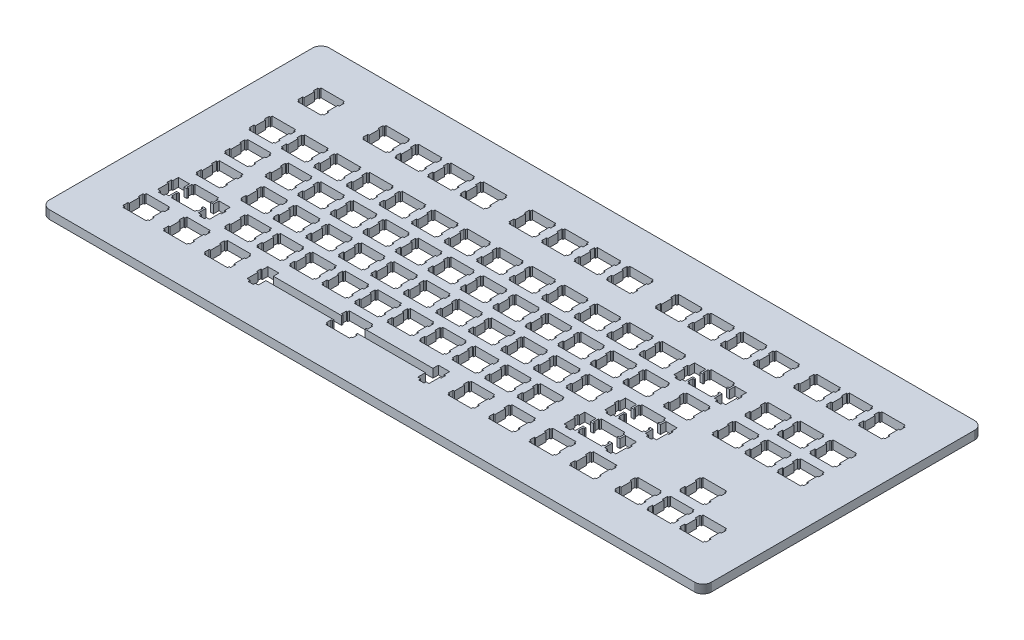
from build123d import *

# Parameters (mm, degrees)
BOSS_EXTRUDE1_DEPTH = 5


with BuildPart() as part:
    # Sketch1 → Boss-Extrude1 (new body)
    with BuildSketch(Plane(origin=(0, 0, 0), x_dir=(1, 0, 0), z_dir=(0, 1, 0))):
        Polygon((382.958, 164.299), (383.35, 164.284), (383.741, 164.237), (384.126, 164.162), (384.503, 164.055), (384.87, 163.919), (385.226, 163.755), (385.572, 163.564), (385.897, 163.344), (386.203, 163.102), (386.493, 162.834), (386.761, 162.547), (387.004, 162.238), (387.223, 161.913), (387.414, 161.569), (387.576, 161.212), (387.713, 160.845), (387.819, 160.467), (387.897, 160.082), (387.943, 159.693), (387.96, 159.299), (387.96, 5.27237), (387.943, 4.881), (387.897, 4.49104), (387.819, 4.10655), (387.713, 3.72759), (387.576, 3.35966), (387.414, 3.00412), (387.223, 2.66099), (387.004, 2.3344), (386.761, 2.02572), (386.493, 1.73771), (386.203, 1.47037), (385.897, 1.22783), (385.572, 1.0101), (385.226, 0.818554), (384.87, 0.654569), (384.503, 0.518142), (384.126, 0.412034), (383.741, 0.334863), (383.35, 0.289388), (382.958, 0.272852), (5.09598, 0.272852), (4.70186, 0.289388), (4.3119, 0.334863), (3.9274, 0.412034), (3.54983, 0.518142), (3.18189, 0.654569), (2.82498, 0.818554), (2.48185, 1.0101), (2.15663, 1.22783), (1.84795, 1.47037), (1.55994, 1.73771), (1.2926, 2.02572), (1.05006, 2.3344), (0.830957, 2.66099), (0.63941, 3.00412), (0.475424, 3.35966), (0.338998, 3.72759), (0.232888, 4.10655), (0.157097, 4.49104), (0.110243, 4.881), (0.0950846, 5.27375), (0.0950846, 159.299), (0.110243, 159.693), (0.157097, 160.082), (0.232888, 160.467), (0.338998, 160.845), (0.475424, 161.212), (0.63941, 161.569), (0.830957, 161.913), (1.05006, 162.238), (1.2926, 162.547), (1.55994, 162.834), (1.84795, 163.102), (2.15663, 163.344), (2.48185, 163.564), (2.82498, 163.755), (3.18189, 163.919), (3.54983, 164.055), (3.9274, 164.162), (4.3119, 164.237), (4.70186, 164.284), (5.09598, 164.299), align=None)
        Polygon((144.264, 36.7993), (144.264, 35.7988), (143.463, 35.7988), (143.463, 32.8993), (144.264, 32.8993), (144.264, 32.0986), (104.439, 32.0986), (104.439, 35.3289), (97.8888, 35.3289), (97.8888, 32.0986), (97.0636, 32.0986), (97.0636, 29.4983), (97.8888, 29.4983), (97.8888, 23.2296), (99.6128, 23.2296), (99.6128, 22.0293), (102.713, 22.0293), (102.713, 23.2296), (104.439, 23.2296), (104.439, 27.6986), (144.264, 27.6986), (144.264, 26.8993), (143.463, 26.8993), (143.463, 23.9985), (144.264, 23.9985), (144.264, 22.9995), (158.064, 22.9995), (158.064, 23.9985), (158.863, 23.9985), (158.863, 26.8993), (158.064, 26.8993), (158.064, 27.6986), (197.889, 27.6986), (197.889, 23.2296), (199.613, 23.2296), (199.613, 22.0293), (202.714, 22.0293), (202.714, 23.2296), (204.439, 23.2296), (204.439, 29.4983), (205.263, 29.4983), (205.263, 32.0986), (204.439, 32.0986), (204.439, 35.3289), (197.889, 35.3289), (197.889, 32.0986), (158.064, 32.0986), (158.064, 32.8993), (158.863, 32.8993), (158.863, 35.7988), (158.064, 35.7988), (158.064, 36.7993), align=None, mode=Mode.SUBTRACT)
        Polygon((351.433, 36.7993), (351.433, 35.7988), (350.632, 35.7988), (350.632, 32.8993), (351.433, 32.8993), (351.433, 26.8993), (350.632, 26.8993), (350.632, 23.9985), (351.433, 23.9985), (351.433, 22.9995), (365.231, 22.9995), (365.231, 23.9985), (366.032, 23.9985), (366.032, 26.8993), (365.231, 26.8993), (365.231, 32.8993), (366.032, 32.8993), (366.032, 35.7988), (365.231, 35.7988), (365.231, 36.7993), align=None, mode=Mode.SUBTRACT)
        Polygon((332.383, 36.7993), (332.383, 35.7988), (331.582, 35.7988), (331.582, 32.8993), (332.383, 32.8993), (332.383, 26.8993), (331.582, 26.8993), (331.582, 23.9985), (332.383, 23.9985), (332.383, 22.9995), (346.183, 22.9995), (346.183, 23.9985), (346.983, 23.9985), (346.983, 26.8993), (346.183, 26.8993), (346.183, 32.8993), (346.983, 32.8993), (346.983, 35.7988), (346.183, 35.7988), (346.183, 36.7993), align=None, mode=Mode.SUBTRACT)
        Polygon((313.333, 36.7993), (313.333, 35.7988), (312.532, 35.7988), (312.532, 32.8993), (313.333, 32.8993), (313.333, 26.8993), (312.532, 26.8993), (312.532, 23.9985), (313.333, 23.9985), (313.333, 22.9995), (327.133, 22.9995), (327.133, 23.9985), (327.933, 23.9985), (327.933, 26.8993), (327.133, 26.8993), (327.133, 32.8993), (327.933, 32.8993), (327.933, 35.7988), (327.133, 35.7988), (327.133, 36.7993), align=None, mode=Mode.SUBTRACT)
        Polygon((287.139, 36.7993), (287.139, 35.7988), (286.338, 35.7988), (286.338, 32.8993), (287.139, 32.8993), (287.139, 26.8993), (286.338, 26.8993), (286.338, 23.9985), (287.139, 23.9985), (287.139, 22.9995), (300.939, 22.9995), (300.939, 23.9985), (301.738, 23.9985), (301.738, 26.8993), (300.939, 26.8993), (300.939, 32.8993), (301.738, 32.8993), (301.738, 35.7988), (300.939, 35.7988), (300.939, 36.7993), align=None, mode=Mode.SUBTRACT)
        Polygon((263.327, 36.7993), (263.327, 35.7988), (262.526, 35.7988), (262.526, 32.8993), (263.327, 32.8993), (263.327, 26.8993), (262.526, 26.8993), (262.526, 23.9985), (263.327, 23.9985), (263.327, 22.9995), (277.126, 22.9995), (277.126, 23.9985), (277.927, 23.9985), (277.927, 26.8993), (277.126, 26.8993), (277.126, 32.8993), (277.927, 32.8993), (277.927, 35.7988), (277.126, 35.7988), (277.126, 36.7993), align=None, mode=Mode.SUBTRACT)
        Polygon((239.514, 36.7993), (239.514, 35.7988), (238.713, 35.7988), (238.713, 32.8993), (239.514, 32.8993), (239.514, 26.8993), (238.713, 26.8993), (238.713, 23.9985), (239.514, 23.9985), (239.514, 22.9995), (253.314, 22.9995), (253.314, 23.9985), (254.113, 23.9985), (254.113, 26.8993), (253.314, 26.8993), (253.314, 32.8993), (254.113, 32.8993), (254.113, 35.7988), (253.314, 35.7988), (253.314, 36.7993), align=None, mode=Mode.SUBTRACT)
        Polygon((215.702, 36.7993), (215.702, 35.7988), (214.901, 35.7988), (214.901, 32.8993), (215.702, 32.8993), (215.702, 26.8993), (214.901, 26.8993), (214.901, 23.9985), (215.702, 23.9985), (215.702, 22.9995), (229.501, 22.9995), (229.501, 23.9985), (230.302, 23.9985), (230.302, 26.8993), (229.501, 26.8993), (229.501, 32.8993), (230.302, 32.8993), (230.302, 35.7988), (229.501, 35.7988), (229.501, 36.7993), align=None, mode=Mode.SUBTRACT)
        Polygon((72.8267, 36.7993), (72.8267, 35.7988), (72.0259, 35.7988), (72.0259, 32.8993), (72.8267, 32.8993), (72.8267, 26.8993), (72.0259, 26.8993), (72.0259, 23.9985), (72.8267, 23.9985), (72.8267, 22.9995), (86.6263, 22.9995), (86.6263, 23.9985), (87.4268, 23.9985), (87.4268, 26.8993), (86.6263, 26.8993), (86.6263, 32.8993), (87.4268, 32.8993), (87.4268, 35.7988), (86.6263, 35.7988), (86.6263, 36.7993), align=None, mode=Mode.SUBTRACT)
        Polygon((49.0142, 36.7993), (49.0142, 35.7988), (48.2134, 35.7988), (48.2134, 32.8993), (49.0142, 32.8993), (49.0142, 26.8993), (48.2134, 26.8993), (48.2134, 23.9985), (49.0142, 23.9985), (49.0142, 22.9995), (62.8138, 22.9995), (62.8138, 23.9985), (63.6129, 23.9985), (63.6129, 26.8993), (62.8138, 26.8993), (62.8138, 32.8993), (63.6129, 32.8993), (63.6129, 35.7988), (62.8138, 35.7988), (62.8138, 36.7993), align=None, mode=Mode.SUBTRACT)
        Polygon((25.2016, 36.7993), (25.2016, 35.7988), (24.4009, 35.7988), (24.4009, 32.8993), (25.2016, 32.8993), (25.2016, 26.8993), (24.4009, 26.8993), (24.4009, 23.9985), (25.2016, 23.9985), (25.2016, 22.9995), (39.0013, 22.9995), (39.0013, 23.9985), (39.8018, 23.9985), (39.8018, 26.8993), (39.0013, 26.8993), (39.0013, 32.8993), (39.8018, 32.8993), (39.8018, 35.7988), (39.0013, 35.7988), (39.0013, 36.7993), align=None, mode=Mode.SUBTRACT)
        Polygon((272.852, 55.8504), (272.852, 54.8499), (272.051, 54.8499), (272.051, 51.9493), (272.852, 51.9493), (272.852, 51.15), (271.126, 51.15), (271.126, 54.38), (264.576, 54.38), (264.576, 51.15), (263.751, 51.15), (263.751, 48.5482), (264.576, 48.5482), (264.576, 42.2797), (266.302, 42.2797), (266.302, 41.0792), (269.401, 41.0792), (269.401, 42.2797), (271.126, 42.2797), (271.126, 46.7487), (272.852, 46.7487), (272.852, 45.9493), (272.051, 45.9493), (272.051, 43.0484), (272.852, 43.0484), (272.852, 42.0493), (286.651, 42.0493), (286.651, 43.0484), (287.452, 43.0484), (287.452, 45.9493), (286.651, 45.9493), (286.651, 46.7487), (288.376, 46.7487), (288.376, 42.2797), (290.102, 42.2797), (290.102, 41.0792), (293.201, 41.0792), (293.201, 42.2797), (294.926, 42.2797), (294.926, 48.5482), (295.752, 48.5482), (295.752, 51.15), (294.926, 51.15), (294.926, 54.38), (288.376, 54.38), (288.376, 51.15), (286.651, 51.15), (286.651, 51.9493), (287.452, 51.9493), (287.452, 54.8499), (286.651, 54.8499), (286.651, 55.8504), align=None, mode=Mode.SUBTRACT)
        Polygon((34.7266, 55.8504), (34.7266, 54.8499), (33.9259, 54.8499), (33.9259, 51.9493), (34.7266, 51.9493), (34.7266, 51.15), (33.0013, 51.15), (33.0013, 54.38), (26.4515, 54.38), (26.4515, 51.15), (25.626, 51.15), (25.626, 48.5482), (26.4515, 48.5482), (26.4515, 42.2797), (28.1767, 42.2797), (28.1767, 41.0792), (31.276, 41.0792), (31.276, 42.2797), (33.0013, 42.2797), (33.0013, 46.7487), (34.7266, 46.7487), (34.7266, 45.9493), (33.9259, 45.9493), (33.9259, 43.0484), (34.7266, 43.0484), (34.7266, 42.0493), (48.5263, 42.0493), (48.5263, 43.0484), (49.3268, 43.0484), (49.3268, 45.9493), (48.5263, 45.9493), (48.5263, 46.7487), (50.2514, 46.7487), (50.2514, 42.2797), (51.9769, 42.2797), (51.9769, 41.0792), (55.076, 41.0792), (55.076, 42.2797), (56.8015, 42.2797), (56.8015, 48.5482), (57.627, 48.5482), (57.627, 51.15), (56.8015, 51.15), (56.8015, 54.38), (50.2514, 54.38), (50.2514, 51.15), (48.5263, 51.15), (48.5263, 51.9493), (49.3268, 51.9493), (49.3268, 54.8499), (48.5263, 54.8499), (48.5263, 55.8504), align=None, mode=Mode.SUBTRACT)
        Polygon((332.383, 55.8504), (332.383, 54.8499), (331.582, 54.8499), (331.582, 51.9493), (332.383, 51.9493), (332.383, 45.9493), (331.582, 45.9493), (331.582, 43.0484), (332.383, 43.0484), (332.383, 42.0493), (346.183, 42.0493), (346.183, 43.0484), (346.983, 43.0484), (346.983, 45.9493), (346.183, 45.9493), (346.183, 51.9493), (346.983, 51.9493), (346.983, 54.8499), (346.183, 54.8499), (346.183, 55.8504), align=None, mode=Mode.SUBTRACT)
        Polygon((237.133, 55.8504), (237.133, 54.8499), (236.332, 54.8499), (236.332, 51.9493), (237.133, 51.9493), (237.133, 45.9493), (236.332, 45.9493), (236.332, 43.0484), (237.133, 43.0484), (237.133, 42.0493), (250.933, 42.0493), (250.933, 43.0484), (251.733, 43.0484), (251.733, 45.9493), (250.933, 45.9493), (250.933, 51.9493), (251.733, 51.9493), (251.733, 54.8499), (250.933, 54.8499), (250.933, 55.8504), align=None, mode=Mode.SUBTRACT)
        Polygon((218.083, 55.8504), (218.083, 54.8499), (217.282, 54.8499), (217.282, 51.9493), (218.083, 51.9493), (218.083, 45.9493), (217.282, 45.9493), (217.282, 43.0484), (218.083, 43.0484), (218.083, 42.0493), (231.883, 42.0493), (231.883, 43.0484), (232.683, 43.0484), (232.683, 45.9493), (231.883, 45.9493), (231.883, 51.9493), (232.683, 51.9493), (232.683, 54.8499), (231.883, 54.8499), (231.883, 55.8504), align=None, mode=Mode.SUBTRACT)
        Polygon((199.033, 55.8504), (199.033, 54.8499), (198.232, 54.8499), (198.232, 51.9493), (199.033, 51.9493), (199.033, 45.9493), (198.232, 45.9493), (198.232, 43.0484), (199.033, 43.0484), (199.033, 42.0493), (212.833, 42.0493), (212.833, 43.0484), (213.633, 43.0484), (213.633, 45.9493), (212.833, 45.9493), (212.833, 51.9493), (213.633, 51.9493), (213.633, 54.8499), (212.833, 54.8499), (212.833, 55.8504), align=None, mode=Mode.SUBTRACT)
        Polygon((179.983, 55.8504), (179.983, 54.8499), (179.182, 54.8499), (179.182, 51.9493), (179.983, 51.9493), (179.983, 45.9493), (179.182, 45.9493), (179.182, 43.0484), (179.983, 43.0484), (179.983, 42.0493), (193.783, 42.0493), (193.783, 43.0484), (194.583, 43.0484), (194.583, 45.9493), (193.783, 45.9493), (193.783, 51.9493), (194.583, 51.9493), (194.583, 54.8499), (193.783, 54.8499), (193.783, 55.8504), align=None, mode=Mode.SUBTRACT)
        Polygon((160.933, 55.8504), (160.933, 54.8499), (160.132, 54.8499), (160.132, 51.9493), (160.933, 51.9493), (160.933, 45.9493), (160.132, 45.9493), (160.132, 43.0484), (160.933, 43.0484), (160.933, 42.0493), (174.733, 42.0493), (174.733, 43.0484), (175.533, 43.0484), (175.533, 45.9493), (174.733, 45.9493), (174.733, 51.9493), (175.533, 51.9493), (175.533, 54.8499), (174.733, 54.8499), (174.733, 55.8504), align=None, mode=Mode.SUBTRACT)
        Polygon((141.883, 55.8504), (141.883, 54.8499), (141.082, 54.8499), (141.082, 51.9493), (141.883, 51.9493), (141.883, 45.9493), (141.082, 45.9493), (141.082, 43.0484), (141.883, 43.0484), (141.883, 42.0493), (155.683, 42.0493), (155.683, 43.0484), (156.483, 43.0484), (156.483, 45.9493), (155.683, 45.9493), (155.683, 51.9493), (156.483, 51.9493), (156.483, 54.8499), (155.683, 54.8499), (155.683, 55.8504), align=None, mode=Mode.SUBTRACT)
        Polygon((122.833, 55.8504), (122.833, 54.8499), (122.032, 54.8499), (122.032, 51.9493), (122.833, 51.9493), (122.833, 45.9493), (122.032, 45.9493), (122.032, 43.0484), (122.833, 43.0484), (122.833, 42.0493), (136.633, 42.0493), (136.633, 43.0484), (137.433, 43.0484), (137.433, 45.9493), (136.633, 45.9493), (136.633, 51.9493), (137.433, 51.9493), (137.433, 54.8499), (136.633, 54.8499), (136.633, 55.8504), align=None, mode=Mode.SUBTRACT)
        Polygon((103.783, 55.8504), (103.783, 54.8499), (102.982, 54.8499), (102.982, 51.9493), (103.783, 51.9493), (103.783, 45.9493), (102.982, 45.9493), (102.982, 43.0484), (103.783, 43.0484), (103.783, 42.0493), (117.583, 42.0493), (117.583, 43.0484), (118.383, 43.0484), (118.383, 45.9493), (117.583, 45.9493), (117.583, 51.9493), (118.383, 51.9493), (118.383, 54.8499), (117.583, 54.8499), (117.583, 55.8504), align=None, mode=Mode.SUBTRACT)
        Polygon((84.733, 55.8504), (84.733, 54.8499), (83.9322, 54.8499), (83.9322, 51.9493), (84.733, 51.9493), (84.733, 45.9493), (83.9322, 45.9493), (83.9322, 43.0484), (84.733, 43.0484), (84.733, 42.0493), (98.5326, 42.0493), (98.5326, 43.0484), (99.3331, 43.0484), (99.3331, 45.9493), (98.5326, 45.9493), (98.5326, 51.9493), (99.3331, 51.9493), (99.3331, 54.8499), (98.5326, 54.8499), (98.5326, 55.8504), align=None, mode=Mode.SUBTRACT)
        Polygon((65.683, 55.8504), (65.683, 54.8499), (64.8822, 54.8499), (64.8822, 51.9493), (65.683, 51.9493), (65.683, 45.9493), (64.8822, 45.9493), (64.8822, 43.0484), (65.683, 43.0484), (65.683, 42.0493), (79.4826, 42.0493), (79.4826, 43.0484), (80.2831, 43.0484), (80.2831, 45.9493), (79.4826, 45.9493), (79.4826, 51.9493), (80.2831, 51.9493), (80.2831, 54.8499), (79.4826, 54.8499), (79.4826, 55.8504), align=None, mode=Mode.SUBTRACT)
        Polygon((277.614, 74.9004), (277.614, 73.8999), (276.813, 73.8999), (276.813, 70.9993), (277.614, 70.9993), (277.614, 70.1985), (275.889, 70.1985), (275.889, 73.43), (269.339, 73.43), (269.339, 70.1985), (268.514, 70.1985), (268.514, 67.5982), (269.339, 67.5982), (269.339, 61.3297), (271.063, 61.3297), (271.063, 60.1292), (274.163, 60.1292), (274.163, 61.3297), (275.889, 61.3297), (275.889, 65.7987), (277.614, 65.7987), (277.614, 64.9993), (276.813, 64.9993), (276.813, 62.0984), (277.614, 62.0984), (277.614, 61.0994), (291.414, 61.0994), (291.414, 62.0984), (292.213, 62.0984), (292.213, 64.9993), (291.414, 64.9993), (291.414, 65.7987), (293.139, 65.7987), (293.139, 61.3297), (294.863, 61.3297), (294.863, 60.1292), (297.964, 60.1292), (297.964, 61.3297), (299.689, 61.3297), (299.689, 67.5982), (300.513, 67.5982), (300.513, 70.1985), (299.689, 70.1985), (299.689, 73.43), (293.139, 73.43), (293.139, 70.1985), (291.414, 70.1985), (291.414, 70.9993), (292.213, 70.9993), (292.213, 73.8999), (291.414, 73.8999), (291.414, 74.9004), align=None, mode=Mode.SUBTRACT)
        Polygon((246.658, 74.9004), (246.658, 73.8999), (245.857, 73.8999), (245.857, 70.9993), (246.658, 70.9993), (246.658, 64.9993), (245.857, 64.9993), (245.857, 62.0984), (246.658, 62.0984), (246.658, 61.0994), (260.458, 61.0994), (260.458, 62.0984), (261.258, 62.0984), (261.258, 64.9993), (260.458, 64.9993), (260.458, 70.9993), (261.258, 70.9993), (261.258, 73.8999), (260.458, 73.8999), (260.458, 74.9004), align=None, mode=Mode.SUBTRACT)
        Polygon((227.608, 74.9004), (227.608, 73.8999), (226.807, 73.8999), (226.807, 70.9993), (227.608, 70.9993), (227.608, 64.9993), (226.807, 64.9993), (226.807, 62.0984), (227.608, 62.0984), (227.608, 61.0994), (241.408, 61.0994), (241.408, 62.0984), (242.208, 62.0984), (242.208, 64.9993), (241.408, 64.9993), (241.408, 70.9993), (242.208, 70.9993), (242.208, 73.8999), (241.408, 73.8999), (241.408, 74.9004), align=None, mode=Mode.SUBTRACT)
        Polygon((208.558, 74.9004), (208.558, 73.8999), (207.757, 73.8999), (207.757, 70.9993), (208.558, 70.9993), (208.558, 64.9993), (207.757, 64.9993), (207.757, 62.0984), (208.558, 62.0984), (208.558, 61.0994), (222.358, 61.0994), (222.358, 62.0984), (223.158, 62.0984), (223.158, 64.9993), (222.358, 64.9993), (222.358, 70.9993), (223.158, 70.9993), (223.158, 73.8999), (222.358, 73.8999), (222.358, 74.9004), align=None, mode=Mode.SUBTRACT)
        Polygon((189.508, 74.9004), (189.508, 73.8999), (188.707, 73.8999), (188.707, 70.9993), (189.508, 70.9993), (189.508, 64.9993), (188.707, 64.9993), (188.707, 62.0984), (189.508, 62.0984), (189.508, 61.0994), (203.308, 61.0994), (203.308, 62.0984), (204.108, 62.0984), (204.108, 64.9993), (203.308, 64.9993), (203.308, 70.9993), (204.108, 70.9993), (204.108, 73.8999), (203.308, 73.8999), (203.308, 74.9004), align=None, mode=Mode.SUBTRACT)
        Polygon((170.458, 74.9004), (170.458, 73.8999), (169.657, 73.8999), (169.657, 70.9993), (170.458, 70.9993), (170.458, 64.9993), (169.657, 64.9993), (169.657, 62.0984), (170.458, 62.0984), (170.458, 61.0994), (184.258, 61.0994), (184.258, 62.0984), (185.058, 62.0984), (185.058, 64.9993), (184.258, 64.9993), (184.258, 70.9993), (185.058, 70.9993), (185.058, 73.8999), (184.258, 73.8999), (184.258, 74.9004), align=None, mode=Mode.SUBTRACT)
        Polygon((151.408, 74.9004), (151.408, 73.8999), (150.607, 73.8999), (150.607, 70.9993), (151.408, 70.9993), (151.408, 64.9993), (150.607, 64.9993), (150.607, 62.0984), (151.408, 62.0984), (151.408, 61.0994), (165.208, 61.0994), (165.208, 62.0984), (166.008, 62.0984), (166.008, 64.9993), (165.208, 64.9993), (165.208, 70.9993), (166.008, 70.9993), (166.008, 73.8999), (165.208, 73.8999), (165.208, 74.9004), align=None, mode=Mode.SUBTRACT)
        Polygon((132.358, 74.9004), (132.358, 73.8999), (131.557, 73.8999), (131.557, 70.9993), (132.358, 70.9993), (132.358, 64.9993), (131.557, 64.9993), (131.557, 62.0984), (132.358, 62.0984), (132.358, 61.0994), (146.158, 61.0994), (146.158, 62.0984), (146.958, 62.0984), (146.958, 64.9993), (146.158, 64.9993), (146.158, 70.9993), (146.958, 70.9993), (146.958, 73.8999), (146.158, 73.8999), (146.158, 74.9004), align=None, mode=Mode.SUBTRACT)
        Polygon((113.308, 74.9004), (113.308, 73.8999), (112.507, 73.8999), (112.507, 70.9993), (113.308, 70.9993), (113.308, 64.9993), (112.507, 64.9993), (112.507, 62.0984), (113.308, 62.0984), (113.308, 61.0994), (127.108, 61.0994), (127.108, 62.0984), (127.908, 62.0984), (127.908, 64.9993), (127.108, 64.9993), (127.108, 70.9993), (127.908, 70.9993), (127.908, 73.8999), (127.108, 73.8999), (127.108, 74.9004), align=None, mode=Mode.SUBTRACT)
        Polygon((94.258, 74.9004), (94.258, 73.8999), (93.4572, 73.8999), (93.4572, 70.9993), (94.258, 70.9993), (94.258, 64.9993), (93.4572, 64.9993), (93.4572, 62.0984), (94.258, 62.0984), (94.258, 61.0994), (108.058, 61.0994), (108.058, 62.0984), (108.858, 62.0984), (108.858, 64.9993), (108.058, 64.9993), (108.058, 70.9993), (108.858, 70.9993), (108.858, 73.8999), (108.058, 73.8999), (108.058, 74.9004), align=None, mode=Mode.SUBTRACT)
        Polygon((75.208, 74.9004), (75.208, 73.8999), (74.4072, 73.8999), (74.4072, 70.9993), (75.208, 70.9993), (75.208, 64.9993), (74.4072, 64.9993), (74.4072, 62.0984), (75.208, 62.0984), (75.208, 61.0994), (89.0076, 61.0994), (89.0076, 62.0984), (89.8081, 62.0984), (89.8081, 64.9993), (89.0076, 64.9993), (89.0076, 70.9993), (89.8081, 70.9993), (89.8081, 73.8999), (89.0076, 73.8999), (89.0076, 74.9004), align=None, mode=Mode.SUBTRACT)
        Polygon((56.158, 74.9004), (56.158, 73.8999), (55.3572, 73.8999), (55.3572, 70.9993), (56.158, 70.9993), (56.158, 64.9993), (55.3572, 64.9993), (55.3572, 62.0984), (56.158, 62.0984), (56.158, 61.0994), (69.9576, 61.0994), (69.9576, 62.0984), (70.7581, 62.0984), (70.7581, 64.9993), (69.9576, 64.9993), (69.9576, 70.9993), (70.7581, 70.9993), (70.7581, 73.8999), (69.9576, 73.8999), (69.9576, 74.9004), align=None, mode=Mode.SUBTRACT)
        Polygon((29.9641, 74.9004), (29.9641, 73.8999), (29.1634, 73.8999), (29.1634, 70.9993), (29.9641, 70.9993), (29.9641, 64.9993), (29.1634, 64.9993), (29.1634, 62.0984), (29.9641, 62.0984), (29.9641, 61.0994), (43.7638, 61.0994), (43.7638, 62.0984), (44.5629, 62.0984), (44.5629, 64.9993), (43.7638, 64.9993), (43.7638, 70.9993), (44.5629, 70.9993), (44.5629, 73.8999), (43.7638, 73.8999), (43.7638, 74.9004), align=None, mode=Mode.SUBTRACT)
        Polygon((351.433, 93.9493), (351.433, 92.9488), (350.632, 92.9488), (350.632, 90.0493), (351.433, 90.0493), (351.433, 84.0493), (350.632, 84.0493), (350.632, 81.1484), (351.433, 81.1484), (351.433, 80.1494), (365.231, 80.1494), (365.231, 81.1484), (366.032, 81.1484), (366.032, 84.0493), (365.231, 84.0493), (365.231, 90.0493), (366.032, 90.0493), (366.032, 92.9488), (365.231, 92.9488), (365.231, 93.9493), align=None, mode=Mode.SUBTRACT)
        Polygon((332.383, 93.9493), (332.383, 92.9488), (331.582, 92.9488), (331.582, 90.0493), (332.383, 90.0493), (332.383, 84.0493), (331.582, 84.0493), (331.582, 81.1484), (332.383, 81.1484), (332.383, 80.1494), (346.183, 80.1494), (346.183, 81.1484), (346.983, 81.1484), (346.983, 84.0493), (346.183, 84.0493), (346.183, 90.0493), (346.983, 90.0493), (346.983, 92.9488), (346.183, 92.9488), (346.183, 93.9493), align=None, mode=Mode.SUBTRACT)
        Polygon((313.333, 93.9493), (313.333, 92.9488), (312.532, 92.9488), (312.532, 90.0493), (313.333, 90.0493), (313.333, 84.0493), (312.532, 84.0493), (312.532, 81.1484), (313.333, 81.1484), (313.333, 80.1494), (327.133, 80.1494), (327.133, 81.1484), (327.933, 81.1484), (327.933, 84.0493), (327.133, 84.0493), (327.133, 90.0493), (327.933, 90.0493), (327.933, 92.9488), (327.133, 92.9488), (327.133, 93.9493), align=None, mode=Mode.SUBTRACT)
        Polygon((284.758, 93.9493), (284.758, 92.9488), (283.957, 92.9488), (283.957, 90.0493), (284.758, 90.0493), (284.758, 84.0493), (283.957, 84.0493), (283.957, 81.1484), (284.758, 81.1484), (284.758, 80.1494), (298.558, 80.1494), (298.558, 81.1484), (299.358, 81.1484), (299.358, 84.0493), (298.558, 84.0493), (298.558, 90.0493), (299.358, 90.0493), (299.358, 92.9488), (298.558, 92.9488), (298.558, 93.9493), align=None, mode=Mode.SUBTRACT)
        Polygon((260.945, 93.9493), (260.945, 92.9488), (260.146, 92.9488), (260.146, 90.0493), (260.945, 90.0493), (260.945, 84.0493), (260.146, 84.0493), (260.146, 81.1484), (260.945, 81.1484), (260.945, 80.1494), (274.745, 80.1494), (274.745, 81.1484), (275.546, 81.1484), (275.546, 84.0493), (274.745, 84.0493), (274.745, 90.0493), (275.546, 90.0493), (275.546, 92.9488), (274.745, 92.9488), (274.745, 93.9493), align=None, mode=Mode.SUBTRACT)
        Polygon((241.895, 93.9493), (241.895, 92.9488), (241.096, 92.9488), (241.096, 90.0493), (241.895, 90.0493), (241.895, 84.0493), (241.096, 84.0493), (241.096, 81.1484), (241.895, 81.1484), (241.895, 80.1494), (255.695, 80.1494), (255.695, 81.1484), (256.494, 81.1484), (256.494, 84.0493), (255.695, 84.0493), (255.695, 90.0493), (256.494, 90.0493), (256.494, 92.9488), (255.695, 92.9488), (255.695, 93.9493), align=None, mode=Mode.SUBTRACT)
        Polygon((222.845, 93.9493), (222.845, 92.9488), (222.046, 92.9488), (222.046, 90.0493), (222.845, 90.0493), (222.845, 84.0493), (222.046, 84.0493), (222.046, 81.1484), (222.845, 81.1484), (222.845, 80.1494), (236.645, 80.1494), (236.645, 81.1484), (237.446, 81.1484), (237.446, 84.0493), (236.645, 84.0493), (236.645, 90.0493), (237.446, 90.0493), (237.446, 92.9488), (236.645, 92.9488), (236.645, 93.9493), align=None, mode=Mode.SUBTRACT)
        Polygon((203.795, 93.9493), (203.795, 92.9488), (202.996, 92.9488), (202.996, 90.0493), (203.795, 90.0493), (203.795, 84.0493), (202.996, 84.0493), (202.996, 81.1484), (203.795, 81.1484), (203.795, 80.1494), (217.595, 80.1494), (217.595, 81.1484), (218.396, 81.1484), (218.396, 84.0493), (217.595, 84.0493), (217.595, 90.0493), (218.396, 90.0493), (218.396, 92.9488), (217.595, 92.9488), (217.595, 93.9493), align=None, mode=Mode.SUBTRACT)
        Polygon((184.745, 93.9493), (184.745, 92.9488), (183.946, 92.9488), (183.946, 90.0493), (184.745, 90.0493), (184.745, 84.0493), (183.946, 84.0493), (183.946, 81.1484), (184.745, 81.1484), (184.745, 80.1494), (198.545, 80.1494), (198.545, 81.1484), (199.346, 81.1484), (199.346, 84.0493), (198.545, 84.0493), (198.545, 90.0493), (199.346, 90.0493), (199.346, 92.9488), (198.545, 92.9488), (198.545, 93.9493), align=None, mode=Mode.SUBTRACT)
        Polygon((165.695, 93.9493), (165.695, 92.9488), (164.896, 92.9488), (164.896, 90.0493), (165.695, 90.0493), (165.695, 84.0493), (164.896, 84.0493), (164.896, 81.1484), (165.695, 81.1484), (165.695, 80.1494), (179.495, 80.1494), (179.495, 81.1484), (180.296, 81.1484), (180.296, 84.0493), (179.495, 84.0493), (179.495, 90.0493), (180.296, 90.0493), (180.296, 92.9488), (179.495, 92.9488), (179.495, 93.9493), align=None, mode=Mode.SUBTRACT)
        Polygon((146.645, 93.9493), (146.645, 92.9488), (145.846, 92.9488), (145.846, 90.0493), (146.645, 90.0493), (146.645, 84.0493), (145.846, 84.0493), (145.846, 81.1484), (146.645, 81.1484), (146.645, 80.1494), (160.445, 80.1494), (160.445, 81.1484), (161.246, 81.1484), (161.246, 84.0493), (160.445, 84.0493), (160.445, 90.0493), (161.246, 90.0493), (161.246, 92.9488), (160.445, 92.9488), (160.445, 93.9493), align=None, mode=Mode.SUBTRACT)
        Polygon((127.595, 93.9493), (127.595, 92.9488), (126.796, 92.9488), (126.796, 90.0493), (127.595, 90.0493), (127.595, 84.0493), (126.796, 84.0493), (126.796, 81.1484), (127.595, 81.1484), (127.595, 80.1494), (141.395, 80.1494), (141.395, 81.1484), (142.196, 81.1484), (142.196, 84.0493), (141.395, 84.0493), (141.395, 90.0493), (142.196, 90.0493), (142.196, 92.9488), (141.395, 92.9488), (141.395, 93.9493), align=None, mode=Mode.SUBTRACT)
        Polygon((108.544, 93.9493), (108.544, 92.9488), (107.745, 92.9488), (107.745, 90.0493), (108.544, 90.0493), (108.544, 84.0493), (107.745, 84.0493), (107.745, 81.1484), (108.544, 81.1484), (108.544, 80.1494), (122.345, 80.1494), (122.345, 81.1484), (123.144, 81.1484), (123.144, 84.0493), (122.345, 84.0493), (122.345, 90.0493), (123.144, 90.0493), (123.144, 92.9488), (122.345, 92.9488), (122.345, 93.9493), align=None, mode=Mode.SUBTRACT)
        Polygon((89.4941, 93.9493), (89.4941, 92.9488), (88.6961, 92.9488), (88.6961, 90.0493), (89.4941, 90.0493), (89.4941, 84.0493), (88.6961, 84.0493), (88.6961, 81.1484), (89.4941, 81.1484), (89.4941, 80.1494), (103.295, 80.1494), (103.295, 81.1484), (104.096, 81.1484), (104.096, 84.0493), (103.295, 84.0493), (103.295, 90.0493), (104.096, 90.0493), (104.096, 92.9488), (103.295, 92.9488), (103.295, 93.9493), align=None, mode=Mode.SUBTRACT)
        Polygon((70.4455, 93.9493), (70.4455, 92.9488), (69.6461, 92.9488), (69.6461, 90.0493), (70.4455, 90.0493), (70.4455, 84.0493), (69.6461, 84.0493), (69.6461, 81.1484), (70.4455, 81.1484), (70.4455, 80.1494), (84.2451, 80.1494), (84.2451, 81.1484), (85.0456, 81.1484), (85.0456, 84.0493), (84.2451, 84.0493), (84.2451, 90.0493), (85.0456, 90.0493), (85.0456, 92.9488), (84.2451, 92.9488), (84.2451, 93.9493), align=None, mode=Mode.SUBTRACT)
        Polygon((51.3955, 93.9493), (51.3955, 92.9488), (50.5961, 92.9488), (50.5961, 90.0493), (51.3955, 90.0493), (51.3955, 84.0493), (50.5961, 84.0493), (50.5961, 81.1484), (51.3955, 81.1484), (51.3955, 80.1494), (65.1951, 80.1494), (65.1951, 81.1484), (65.9956, 81.1484), (65.9956, 84.0493), (65.1951, 84.0493), (65.1951, 90.0493), (65.9956, 90.0493), (65.9956, 92.9488), (65.1951, 92.9488), (65.1951, 93.9493), align=None, mode=Mode.SUBTRACT)
        Polygon((27.5828, 93.9493), (27.5828, 92.9488), (26.7822, 92.9488), (26.7822, 90.0493), (27.5828, 90.0493), (27.5828, 84.0493), (26.7822, 84.0493), (26.7822, 81.1484), (27.5828, 81.1484), (27.5828, 80.1494), (41.3826, 80.1494), (41.3826, 81.1484), (42.183, 81.1484), (42.183, 84.0493), (41.3826, 84.0493), (41.3826, 90.0493), (42.183, 90.0493), (42.183, 92.9488), (41.3826, 92.9488), (41.3826, 93.9493), align=None, mode=Mode.SUBTRACT)
        Polygon((279.995, 112.999), (279.995, 111.999), (279.196, 111.999), (279.196, 109.099), (279.995, 109.099), (279.995, 108.299), (278.27, 108.299), (278.27, 111.529), (271.72, 111.529), (271.72, 108.299), (270.896, 108.299), (270.896, 105.698), (271.72, 105.698), (271.72, 99.4297), (273.445, 99.4297), (273.445, 98.2292), (276.546, 98.2292), (276.546, 99.4297), (278.27, 99.4297), (278.27, 103.899), (279.995, 103.899), (279.995, 103.099), (279.196, 103.099), (279.196, 100.198), (279.995, 100.198), (279.995, 99.1994), (293.795, 99.1994), (293.795, 100.198), (294.596, 100.198), (294.596, 103.099), (293.795, 103.099), (293.795, 103.899), (295.52, 103.899), (295.52, 99.4297), (297.246, 99.4297), (297.246, 98.2292), (300.345, 98.2292), (300.345, 99.4297), (302.07, 99.4297), (302.07, 105.698), (302.896, 105.698), (302.896, 108.299), (302.07, 108.299), (302.07, 111.529), (295.52, 111.529), (295.52, 108.299), (293.795, 108.299), (293.795, 109.099), (294.596, 109.099), (294.596, 111.999), (293.795, 111.999), (293.795, 112.999), align=None, mode=Mode.SUBTRACT)
        Polygon((351.433, 112.999), (351.433, 111.999), (350.632, 111.999), (350.632, 109.099), (351.433, 109.099), (351.433, 103.099), (350.632, 103.099), (350.632, 100.198), (351.433, 100.198), (351.433, 99.1994), (365.231, 99.1994), (365.231, 100.198), (366.032, 100.198), (366.032, 103.099), (365.231, 103.099), (365.231, 109.099), (366.032, 109.099), (366.032, 111.999), (365.231, 111.999), (365.231, 112.999), align=None, mode=Mode.SUBTRACT)
        Polygon((332.383, 112.999), (332.383, 111.999), (331.582, 111.999), (331.582, 109.099), (332.383, 109.099), (332.383, 103.099), (331.582, 103.099), (331.582, 100.198), (332.383, 100.198), (332.383, 99.1994), (346.183, 99.1994), (346.183, 100.198), (346.983, 100.198), (346.983, 103.099), (346.183, 103.099), (346.183, 109.099), (346.983, 109.099), (346.983, 111.999), (346.183, 111.999), (346.183, 112.999), align=None, mode=Mode.SUBTRACT)
        Polygon((313.333, 112.999), (313.333, 111.999), (312.532, 111.999), (312.532, 109.099), (313.333, 109.099), (313.333, 103.099), (312.532, 103.099), (312.532, 100.198), (313.333, 100.198), (313.333, 99.1994), (327.133, 99.1994), (327.133, 100.198), (327.933, 100.198), (327.933, 103.099), (327.133, 103.099), (327.133, 109.099), (327.933, 109.099), (327.933, 111.999), (327.133, 111.999), (327.133, 112.999), align=None, mode=Mode.SUBTRACT)
        Polygon((251.42, 112.999), (251.42, 111.999), (250.621, 111.999), (250.621, 109.099), (251.42, 109.099), (251.42, 103.099), (250.621, 103.099), (250.621, 100.198), (251.42, 100.198), (251.42, 99.1994), (265.22, 99.1994), (265.22, 100.198), (266.021, 100.198), (266.021, 103.099), (265.22, 103.099), (265.22, 109.099), (266.021, 109.099), (266.021, 111.999), (265.22, 111.999), (265.22, 112.999), align=None, mode=Mode.SUBTRACT)
        Polygon((232.37, 112.999), (232.37, 111.999), (231.571, 111.999), (231.571, 109.099), (232.37, 109.099), (232.37, 103.099), (231.571, 103.099), (231.571, 100.198), (232.37, 100.198), (232.37, 99.1994), (246.17, 99.1994), (246.17, 100.198), (246.971, 100.198), (246.971, 103.099), (246.17, 103.099), (246.17, 109.099), (246.971, 109.099), (246.971, 111.999), (246.17, 111.999), (246.17, 112.999), align=None, mode=Mode.SUBTRACT)
        Polygon((213.32, 112.999), (213.32, 111.999), (212.521, 111.999), (212.521, 109.099), (213.32, 109.099), (213.32, 103.099), (212.521, 103.099), (212.521, 100.198), (213.32, 100.198), (213.32, 99.1994), (227.12, 99.1994), (227.12, 100.198), (227.921, 100.198), (227.921, 103.099), (227.12, 103.099), (227.12, 109.099), (227.921, 109.099), (227.921, 111.999), (227.12, 111.999), (227.12, 112.999), align=None, mode=Mode.SUBTRACT)
        Polygon((194.27, 112.999), (194.27, 111.999), (193.471, 111.999), (193.471, 109.099), (194.27, 109.099), (194.27, 103.099), (193.471, 103.099), (193.471, 100.198), (194.27, 100.198), (194.27, 99.1994), (208.07, 99.1994), (208.07, 100.198), (208.871, 100.198), (208.871, 103.099), (208.07, 103.099), (208.07, 109.099), (208.871, 109.099), (208.871, 111.999), (208.07, 111.999), (208.07, 112.999), align=None, mode=Mode.SUBTRACT)
        Polygon((175.22, 112.999), (175.22, 111.999), (174.421, 111.999), (174.421, 109.099), (175.22, 109.099), (175.22, 103.099), (174.421, 103.099), (174.421, 100.198), (175.22, 100.198), (175.22, 99.1994), (189.02, 99.1994), (189.02, 100.198), (189.821, 100.198), (189.821, 103.099), (189.02, 103.099), (189.02, 109.099), (189.821, 109.099), (189.821, 111.999), (189.02, 111.999), (189.02, 112.999), align=None, mode=Mode.SUBTRACT)
        Polygon((156.17, 112.999), (156.17, 111.999), (155.371, 111.999), (155.371, 109.099), (156.17, 109.099), (156.17, 103.099), (155.371, 103.099), (155.371, 100.198), (156.17, 100.198), (156.17, 99.1994), (169.97, 99.1994), (169.97, 100.198), (170.771, 100.198), (170.771, 103.099), (169.97, 103.099), (169.97, 109.099), (170.771, 109.099), (170.771, 111.999), (169.97, 111.999), (169.97, 112.999), align=None, mode=Mode.SUBTRACT)
        Polygon((137.12, 112.999), (137.12, 111.999), (136.321, 111.999), (136.321, 109.099), (137.12, 109.099), (137.12, 103.099), (136.321, 103.099), (136.321, 100.198), (137.12, 100.198), (137.12, 99.1994), (150.92, 99.1994), (150.92, 100.198), (151.721, 100.198), (151.721, 103.099), (150.92, 103.099), (150.92, 109.099), (151.721, 109.099), (151.721, 111.999), (150.92, 111.999), (150.92, 112.999), align=None, mode=Mode.SUBTRACT)
        Polygon((118.07, 112.999), (118.07, 111.999), (117.271, 111.999), (117.271, 109.099), (118.07, 109.099), (118.07, 103.099), (117.271, 103.099), (117.271, 100.198), (118.07, 100.198), (118.07, 99.1994), (131.87, 99.1994), (131.87, 100.198), (132.671, 100.198), (132.671, 103.099), (131.87, 103.099), (131.87, 109.099), (132.671, 109.099), (132.671, 111.999), (131.87, 111.999), (131.87, 112.999), align=None, mode=Mode.SUBTRACT)
        Polygon((99.0191, 112.999), (99.0191, 111.999), (98.2197, 111.999), (98.2197, 109.099), (99.0191, 109.099), (99.0191, 103.099), (98.2197, 103.099), (98.2197, 100.198), (99.0191, 100.198), (99.0191, 99.1994), (112.82, 99.1994), (112.82, 100.198), (113.619, 100.198), (113.619, 103.099), (112.82, 103.099), (112.82, 109.099), (113.619, 109.099), (113.619, 111.999), (112.82, 111.999), (112.82, 112.999), align=None, mode=Mode.SUBTRACT)
        Polygon((79.9691, 112.999), (79.9691, 111.999), (79.1697, 111.999), (79.1697, 109.099), (79.9691, 109.099), (79.9691, 103.099), (79.1697, 103.099), (79.1697, 100.198), (79.9691, 100.198), (79.9691, 99.1994), (93.7701, 99.1994), (93.7701, 100.198), (94.5706, 100.198), (94.5706, 103.099), (93.7701, 103.099), (93.7701, 109.099), (94.5706, 109.099), (94.5706, 111.999), (93.7701, 111.999), (93.7701, 112.999), align=None, mode=Mode.SUBTRACT)
        Polygon((60.9191, 112.999), (60.9191, 111.999), (60.1197, 111.999), (60.1197, 109.099), (60.9191, 109.099), (60.9191, 103.099), (60.1197, 103.099), (60.1197, 100.198), (60.9191, 100.198), (60.9191, 99.1994), (74.7201, 99.1994), (74.7201, 100.198), (75.5206, 100.198), (75.5206, 103.099), (74.7201, 103.099), (74.7201, 109.099), (75.5206, 109.099), (75.5206, 111.999), (74.7201, 111.999), (74.7201, 112.999), align=None, mode=Mode.SUBTRACT)
        Polygon((41.8705, 112.999), (41.8705, 111.999), (41.0697, 111.999), (41.0697, 109.099), (41.8705, 109.099), (41.8705, 103.099), (41.0697, 103.099), (41.0697, 100.198), (41.8705, 100.198), (41.8705, 99.1994), (55.6701, 99.1994), (55.6701, 100.198), (56.4706, 100.198), (56.4706, 103.099), (55.6701, 103.099), (55.6701, 109.099), (56.4706, 109.099), (56.4706, 111.999), (55.6701, 111.999), (55.6701, 112.999), align=None, mode=Mode.SUBTRACT)
        Polygon((22.8203, 112.999), (22.8203, 111.999), (22.0211, 111.999), (22.0211, 109.099), (22.8203, 109.099), (22.8203, 103.099), (22.0211, 103.099), (22.0211, 100.198), (22.8203, 100.198), (22.8203, 99.1994), (36.6201, 99.1994), (36.6201, 100.198), (37.4205, 100.198), (37.4205, 103.099), (36.6201, 103.099), (36.6201, 109.099), (37.4205, 109.099), (37.4205, 111.999), (36.6201, 111.999), (36.6201, 112.999), align=None, mode=Mode.SUBTRACT)
        Polygon((351.433, 141.574), (351.433, 140.574), (350.632, 140.574), (350.632, 137.674), (351.433, 137.674), (351.433, 131.674), (350.632, 131.674), (350.632, 128.773), (351.433, 128.773), (351.433, 127.774), (365.231, 127.774), (365.231, 128.773), (366.032, 128.773), (366.032, 131.674), (365.231, 131.674), (365.231, 137.674), (366.032, 137.674), (366.032, 140.574), (365.231, 140.574), (365.231, 141.574), align=None, mode=Mode.SUBTRACT)
        Polygon((332.383, 141.574), (332.383, 140.574), (331.582, 140.574), (331.582, 137.674), (332.383, 137.674), (332.383, 131.674), (331.582, 131.674), (331.582, 128.773), (332.383, 128.773), (332.383, 127.774), (346.183, 127.774), (346.183, 128.773), (346.983, 128.773), (346.983, 131.674), (346.183, 131.674), (346.183, 137.674), (346.983, 137.674), (346.983, 140.574), (346.183, 140.574), (346.183, 141.574), align=None, mode=Mode.SUBTRACT)
        Polygon((313.333, 141.574), (313.333, 140.574), (312.532, 140.574), (312.532, 137.674), (313.333, 137.674), (313.333, 131.674), (312.532, 131.674), (312.532, 128.773), (313.333, 128.773), (313.333, 127.774), (327.133, 127.774), (327.133, 128.773), (327.933, 128.773), (327.933, 131.674), (327.133, 131.674), (327.133, 137.674), (327.933, 137.674), (327.933, 140.574), (327.133, 140.574), (327.133, 141.574), align=None, mode=Mode.SUBTRACT)
        Polygon((289.52, 141.574), (289.52, 140.574), (288.721, 140.574), (288.721, 137.674), (289.52, 137.674), (289.52, 131.674), (288.721, 131.674), (288.721, 128.773), (289.52, 128.773), (289.52, 127.774), (303.32, 127.774), (303.32, 128.773), (304.121, 128.773), (304.121, 131.674), (303.32, 131.674), (303.32, 137.674), (304.121, 137.674), (304.121, 140.574), (303.32, 140.574), (303.32, 141.574), align=None, mode=Mode.SUBTRACT)
        Polygon((270.47, 141.574), (270.47, 140.574), (269.671, 140.574), (269.671, 137.674), (270.47, 137.674), (270.47, 131.674), (269.671, 131.674), (269.671, 128.773), (270.47, 128.773), (270.47, 127.774), (284.27, 127.774), (284.27, 128.773), (285.071, 128.773), (285.071, 131.674), (284.27, 131.674), (284.27, 137.674), (285.071, 137.674), (285.071, 140.574), (284.27, 140.574), (284.27, 141.574), align=None, mode=Mode.SUBTRACT)
        Polygon((251.42, 141.574), (251.42, 140.574), (250.621, 140.574), (250.621, 137.674), (251.42, 137.674), (251.42, 131.674), (250.621, 131.674), (250.621, 128.773), (251.42, 128.773), (251.42, 127.774), (265.22, 127.774), (265.22, 128.773), (266.021, 128.773), (266.021, 131.674), (265.22, 131.674), (265.22, 137.674), (266.021, 137.674), (266.021, 140.574), (265.22, 140.574), (265.22, 141.574), align=None, mode=Mode.SUBTRACT)
        Polygon((232.37, 141.574), (232.37, 140.574), (231.571, 140.574), (231.571, 137.674), (232.37, 137.674), (232.37, 131.674), (231.571, 131.674), (231.571, 128.773), (232.37, 128.773), (232.37, 127.774), (246.17, 127.774), (246.17, 128.773), (246.971, 128.773), (246.971, 131.674), (246.17, 131.674), (246.17, 137.674), (246.971, 137.674), (246.971, 140.574), (246.17, 140.574), (246.17, 141.574), align=None, mode=Mode.SUBTRACT)
        Polygon((203.795, 141.574), (203.795, 140.574), (202.996, 140.574), (202.996, 137.674), (203.795, 137.674), (203.795, 131.674), (202.996, 131.674), (202.996, 128.773), (203.795, 128.773), (203.795, 127.774), (217.595, 127.774), (217.595, 128.773), (218.396, 128.773), (218.396, 131.674), (217.595, 131.674), (217.595, 137.674), (218.396, 137.674), (218.396, 140.574), (217.595, 140.574), (217.595, 141.574), align=None, mode=Mode.SUBTRACT)
        Polygon((184.745, 141.574), (184.745, 140.574), (183.946, 140.574), (183.946, 137.674), (184.745, 137.674), (184.745, 131.674), (183.946, 131.674), (183.946, 128.773), (184.745, 128.773), (184.745, 127.774), (198.545, 127.774), (198.545, 128.773), (199.346, 128.773), (199.346, 131.674), (198.545, 131.674), (198.545, 137.674), (199.346, 137.674), (199.346, 140.574), (198.545, 140.574), (198.545, 141.574), align=None, mode=Mode.SUBTRACT)
        Polygon((165.695, 141.574), (165.695, 140.574), (164.896, 140.574), (164.896, 137.674), (165.695, 137.674), (165.695, 131.674), (164.896, 131.674), (164.896, 128.773), (165.695, 128.773), (165.695, 127.774), (179.495, 127.774), (179.495, 128.773), (180.296, 128.773), (180.296, 131.674), (179.495, 131.674), (179.495, 137.674), (180.296, 137.674), (180.296, 140.574), (179.495, 140.574), (179.495, 141.574), align=None, mode=Mode.SUBTRACT)
        Polygon((146.644, 141.574), (146.644, 140.574), (145.846, 140.574), (145.846, 137.674), (146.644, 137.674), (146.644, 131.674), (145.846, 131.674), (145.846, 128.773), (146.644, 128.773), (146.644, 127.774), (160.445, 127.774), (160.445, 128.773), (161.244, 128.773), (161.244, 131.674), (160.445, 131.674), (160.445, 137.674), (161.244, 137.674), (161.244, 140.574), (160.445, 140.574), (160.445, 141.574), align=None, mode=Mode.SUBTRACT)
        Polygon((118.07, 141.574), (118.07, 140.574), (117.271, 140.574), (117.271, 137.674), (118.07, 137.674), (118.07, 131.674), (117.271, 131.674), (117.271, 128.773), (118.07, 128.773), (118.07, 127.774), (131.87, 127.774), (131.87, 128.773), (132.671, 128.773), (132.671, 131.674), (131.87, 131.674), (131.87, 137.674), (132.671, 137.674), (132.671, 140.574), (131.87, 140.574), (131.87, 141.574), align=None, mode=Mode.SUBTRACT)
        Polygon((99.0191, 141.574), (99.0191, 140.574), (98.2197, 140.574), (98.2197, 137.674), (99.0191, 137.674), (99.0191, 131.674), (98.2197, 131.674), (98.2197, 128.773), (99.0191, 128.773), (99.0191, 127.774), (112.82, 127.774), (112.82, 128.773), (113.619, 128.773), (113.619, 131.674), (112.82, 131.674), (112.82, 137.674), (113.619, 137.674), (113.619, 140.574), (112.82, 140.574), (112.82, 141.574), align=None, mode=Mode.SUBTRACT)
        Polygon((79.9691, 141.574), (79.9691, 140.574), (79.1697, 140.574), (79.1697, 137.674), (79.9691, 137.674), (79.9691, 131.674), (79.1697, 131.674), (79.1697, 128.773), (79.9691, 128.773), (79.9691, 127.774), (93.7701, 127.774), (93.7701, 128.773), (94.5706, 128.773), (94.5706, 131.674), (93.7701, 131.674), (93.7701, 137.674), (94.5706, 137.674), (94.5706, 140.574), (93.7701, 140.574), (93.7701, 141.574), align=None, mode=Mode.SUBTRACT)
        Polygon((60.9191, 141.574), (60.9191, 140.574), (60.1197, 140.574), (60.1197, 137.674), (60.9191, 137.674), (60.9191, 131.674), (60.1197, 131.674), (60.1197, 128.773), (60.9191, 128.773), (60.9191, 127.774), (74.7201, 127.774), (74.7201, 128.773), (75.5206, 128.773), (75.5206, 131.674), (74.7201, 131.674), (74.7201, 137.674), (75.5206, 137.674), (75.5206, 140.574), (74.7201, 140.574), (74.7201, 141.574), align=None, mode=Mode.SUBTRACT)
        Polygon((22.8203, 141.574), (22.8203, 140.574), (22.0211, 140.574), (22.0211, 137.674), (22.8203, 137.674), (22.8203, 131.674), (22.0211, 131.674), (22.0211, 128.773), (22.8203, 128.773), (22.8203, 127.774), (36.6201, 127.774), (36.6201, 128.773), (37.4205, 128.773), (37.4205, 131.674), (36.6201, 131.674), (36.6201, 137.674), (37.4205, 137.674), (37.4205, 140.574), (36.6201, 140.574), (36.6201, 141.574), align=None, mode=Mode.SUBTRACT)
    extrude(amount=BOSS_EXTRUDE1_DEPTH)


solid = part.part
